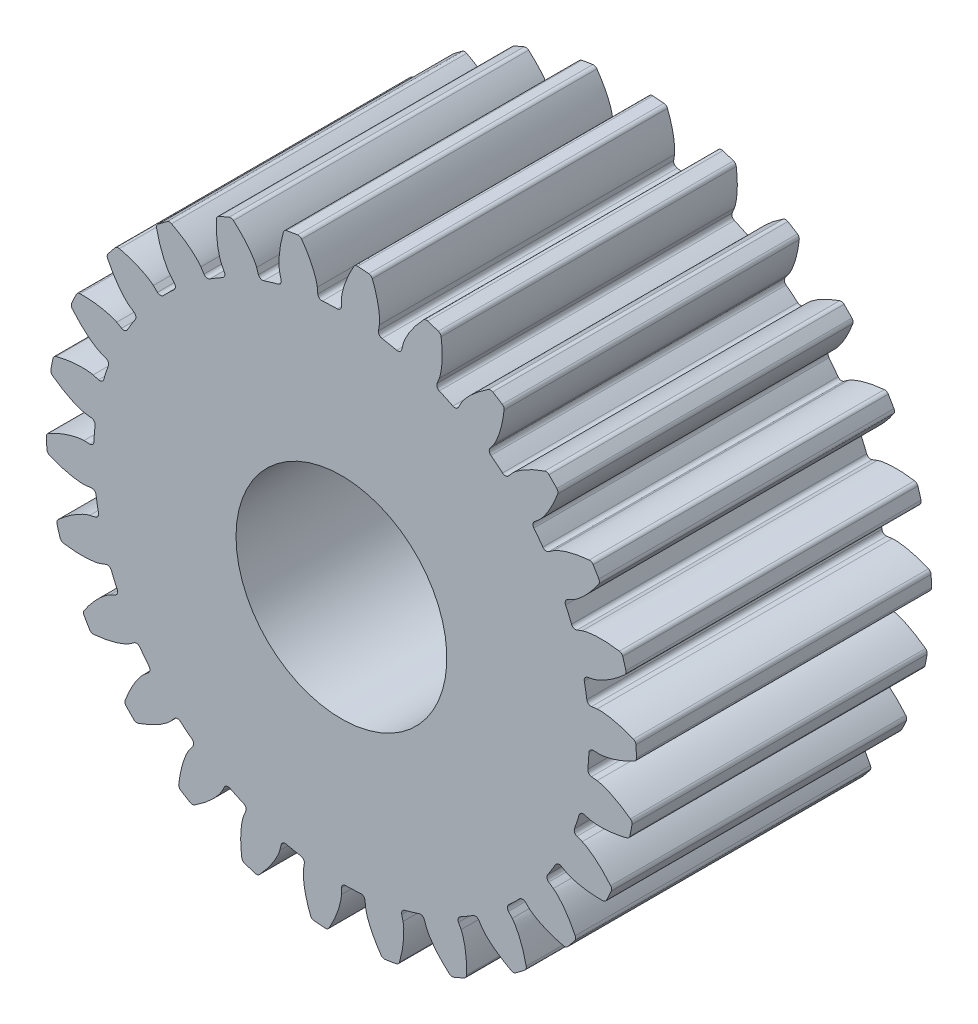
from build123d import *

# Parameters (mm, degrees)
SKETCH2_R           = 11.75
BOSS_EXTRUDE1_DEPTH = 7
BOSS_EXTRUDE2_DEPTH = 7
CIRPATTERN1_COUNT   = 26
SKETCH4_R           = 5
CUT_EXTRUDE1_DEPTH  = 25.238630467
FILLET3_R           = 0.2


with BuildPart() as part:
    # Sketch2 → Boss-Extrude1 (new, symmetric)
    with BuildSketch(Plane.XY):
        Circle(SKETCH2_R)
    extrude(amount=BOSS_EXTRUDE1_DEPTH, both=True)

    # Sketch3 → Boss-Extrude2 (add, symmetric)
    with BuildSketch(Plane.XY):
        with BuildLine():
            Line((0, 12.21600407), (0, 11.75))
            ThreePointArc((0, 11.75), (0.867267602, 11.717949774), (1.729803949, 11.621973942))
            Line((1.729803949, 11.621973942), (1.798407837, 12.082900508))
            add(Edge.make_bspline(
                [(1.798407837, 12.082900508), (1.799866229, 12.092698964), (1.803283192, 12.120272149), (1.807079346, 12.172725672), (1.809469594, 12.258567606), (1.806922738, 12.368155152), (1.797205643, 12.509741264), (1.777515072, 12.676181419), (1.747266742, 12.858368577), (1.705125116, 13.05543244), (1.65496335, 13.250738031), (1.597432245, 13.44410077), (1.532520938, 13.637854139), (1.478671404, 13.782266648), (1.440532417, 13.878542759), (1.420443894, 13.927754275)],
                knots=[0, 0, 0, 0, 0, 0.005376748, 0.015083688, 0.02853182, 0.046610139, 0.064854849, 0.092110525, 0.119476175, 0.146842495, 0.174208853, 0.201574955, 0.228941013, 0.257808339, 0.257808339, 0.257808339, 0.257808339, 0.257808339], degree=4))
            ThreePointArc((1.420443894, 13.927754275), (1.033339749, 13.961812524), (0.645439461, 13.985113797))
            add(Edge.make_bspline(
                [(0, 12.21600407), (0, 12.225910464), (0.000679516, 12.253686252), (0.004646786, 12.306127111), (0.014919993, 12.391385613), (0.033572274, 12.499404172), (0.064027408, 12.638017064), (0.108006293, 12.799744926), (0.164746131, 12.975493931), (0.235439786, 13.16420665), (0.313807346, 13.349999551), (0.39917793, 13.532785875), (0.491905775, 13.714872012), (0.566428544, 13.849783384), (0.618325437, 13.939395708), (0.645439461, 13.985113797)],
                knots=[0, 0, 0, 0, 0, 0.005376748, 0.015083688, 0.02853182, 0.046610139, 0.064854849, 0.092110525, 0.119476175, 0.146842495, 0.174208853, 0.201574955, 0.228941013, 0.257808297, 0.257808297, 0.257808297, 0.257808297, 0.257808297], degree=4))
        make_face()
    boss_extrude2 = extrude(amount=BOSS_EXTRUDE2_DEPTH, both=True)

    # CirPattern1: Boss-Extrude2 ×26 about axis
    cirpattern1_axis = Axis((0, 0, 7), (0, 0, -1))
    for i in range(1, CIRPATTERN1_COUNT):
        add(boss_extrude2.rotate(cirpattern1_axis, i * 360 / CIRPATTERN1_COUNT))

    # Sketch4 → Cut-Extrude1 (cut, through all)
    with BuildSketch(Plane(origin=(0, 0, -7), x_dir=(-1, 0, 0), z_dir=(0, 0, -1))):
        Circle(SKETCH4_R)
    extrude(amount=-CUT_EXTRUDE1_DEPTH, mode=Mode.SUBTRACT)

    # Fillet3
    fillet3_edges = [part.edges().sort_by_distance(p)[0] for p in [
        (-8.582056401, 8.025634425, 0),
        (-9.670060424, 6.674760774, 0),
        (-10.986440852, 4.166607423, 0),
        (-11.328731841, 3.118065888, 0),
        (-11.664329271, 1.416305993, 0),
        (-11.745741492, 0.316317574, 0),
        (-11.664329271, -1.416305993, 0),
        (-11.480131341, -2.503813967, 0),
        (-10.986440852, -4.166607423, 0),
        (-10.547337686, -5.178432942, 0),
        (-9.670060424, -6.674760774, 0),
        (-9.001571102, -7.552100217, 0),
        (-7.791691234, -8.795001291, 0),
        (-6.932665926, -9.486866878, 0),
        (-5.460497272, -10.404108301, 0),
        (-4.460859404, -10.87029132, 0),
        (-2.811959055, -11.408566355, 0),
        (-1.729803949, -11.621973942, 0),
        (0, -11.75, 0),
        (1.101781424, -11.698229682, 0),
        (2.811959055, -11.408566355, 0),
        (3.869335265, -11.094626835, 0),
        (5.460497272, -10.404108301, 0),
        (6.412017406, -9.846244603, 0),
        (7.791691234, -8.795001291, 0),
        (8.582056401, -8.025634425, 0),
        (9.670060424, -6.674760774, 0),
        (10.253337473, -5.738603546, 0),
        (10.986440852, -4.166607423, 0),
        (11.328731841, -3.118065888, 0),
        (11.664329271, -1.416305993, 0),
        (11.745741492, -0.316317574, 0),
        (11.664329271, 1.416305993, 0),
        (11.480131341, 2.503813967, 0),
        (10.986440852, 4.166607423, 0),
        (10.547337686, 5.178432942, 0),
        (9.670060424, 6.674760774, 0),
        (9.001571102, 7.552100217, 0),
        (7.791691234, 8.795001291, 0),
        (6.932665926, 9.486866878, 0),
        (5.460497272, 10.404108301, 0),
        (4.460859404, 10.87029132, 0),
        (2.811959055, 11.408566355, 0),
        (1.729803949, 11.621973942, 0),
        (0, 11.75, 0),
        (-10.253337473, 5.738603546, 0),
        (-1.101781424, 11.698229682, 0),
        (-2.811959055, 11.408566355, 0),
        (-3.869335265, 11.094626835, 0),
        (-5.460497272, 10.404108301, 0),
        (-6.412017406, 9.846244603, 0),
        (-7.791691234, 8.795001291, 0),
        (1.420443894, 13.927754275, -3.5),
        (3.973540962, 13.424268033, -3.5),
        (4.712298142, 13.183104574, -3.5),
        (7.070714705, 12.083252607, -3.5),
        (7.730290751, 11.672300754, -3.5),
        (9.75696421, 10.04000246, -3.5),
        (10.29902696, 9.483145242, -3.5),
        (11.876174421, 7.413263864, -3.5),
        (12.269221157, 6.742863798, -3.5),
        (13.305184543, 4.355693318, -3.5),
        (13.526372818, 3.610711619, -3.5),
        (13.960945701, 1.044985709, -3.5),
        (13.997420856, 0.268718005, -3.5),
        (13.805347441, -2.326452671, -3.5),
        (13.654989674, -3.088892523, -3.5),
        (12.847432568, -5.562686078, -3.5),
        (12.518980125, -6.266987844, -3.5),
        (11.142871613, -8.47563639, -3.5),
        (10.655412955, -9.080868612, -3.5),
        (8.790727463, -10.896013522, -3.5),
        (8.172591916, -11.367002304, -3.5),
        (5.927698185, -12.683153954, -3.5),
        (5.214809541, -12.992527139, -3.5),
        (2.720172635, -13.73319558, -3.5),
        (1.95396139, -13.862973522, -3.5),
        (-0.645439461, -13.985113797, -3.5),
        (-1.420443894, -13.927754275, -3.5),
        (-3.973540962, -13.424268033, -3.5),
        (-4.712298142, -13.183104574, -3.5),
        (-7.070714705, -12.083252607, -3.5),
        (-7.730290751, -11.672300754, -3.5),
        (-9.75696421, -10.04000246, -3.5),
        (-10.29902696, -9.483145242, -3.5),
        (-11.876174421, -7.413263864, -3.5),
        (-12.269221157, -6.742863798, -3.5),
        (-13.305184543, -4.355693318, -3.5),
        (-13.526372818, -3.610711619, -3.5),
        (-13.960945701, -1.044985709, -3.5),
        (-13.997420856, -0.268718005, -3.5),
        (-13.805347441, 2.326452671, -3.5),
        (-13.654989674, 3.088892523, -3.5),
        (-12.847432568, 5.562686078, -3.5),
        (-12.518980125, 6.266987844, -3.5),
        (-11.142871613, 8.47563639, -3.5),
        (-10.655412955, 9.080868612, -3.5),
        (-8.790727463, 10.896013522, -3.5),
        (-8.172591916, 11.367002304, -3.5),
        (-5.927698185, 12.683153954, -3.5),
        (-5.214809541, 12.992527139, -3.5),
        (-2.720172635, 13.73319558, -3.5),
        (-1.95396139, 13.862973522, -3.5),
        (0.645439461, 13.985113797, -3.5),
    ]]
    fillet(fillet3_edges, radius=FILLET3_R)


solid = part.part
